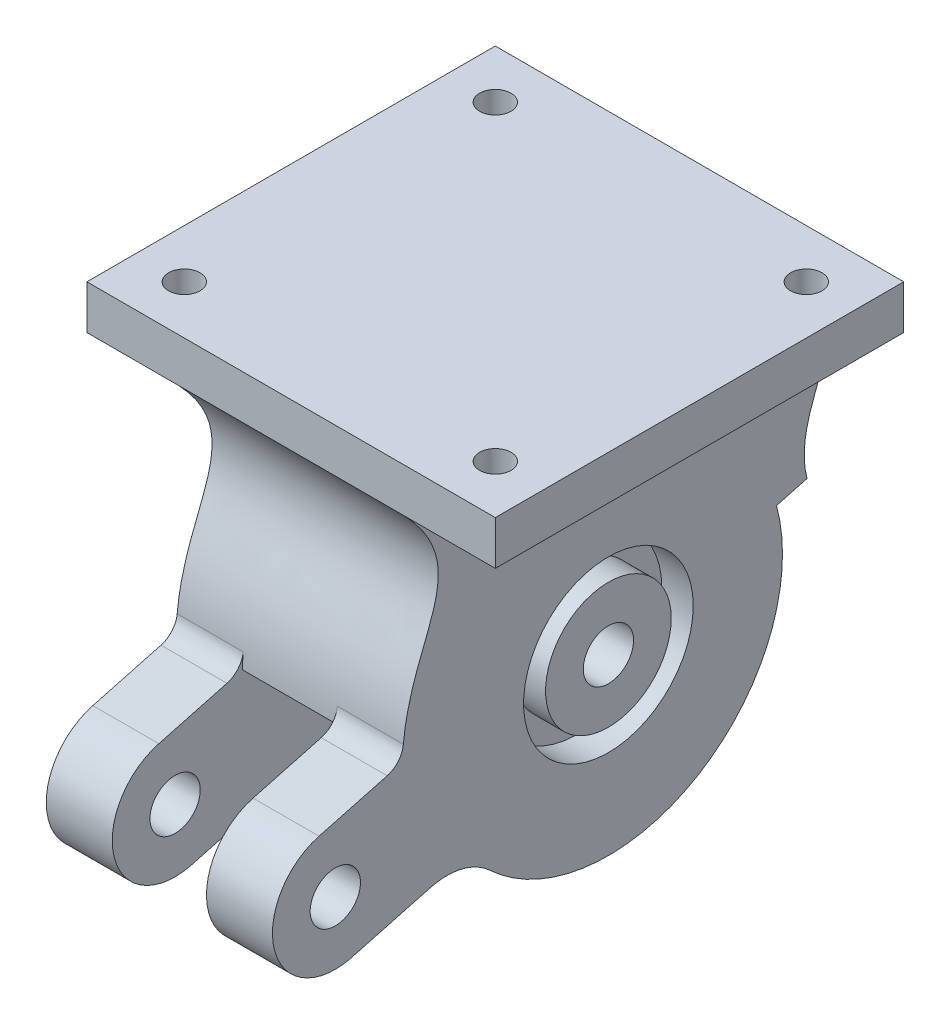
from build123d import *

# Parameters (mm, degrees)
SKETCH1_W                       = 65
SKETCH1_H                       = 65
SKETCH1_R                       = 2.5
BOSS_EXTRUDE1_DEPTH             = 7
BOSS_EXTRUDE2_START             = 7.5
SKETCH2_R                       = 4
BOSS_EXTRUDE2_DEPTH             = 10.5
BOSS_EXTRUDE3_REACH             = 80.065
BOSS_EXTRUDE3_DIRECTION_2_REACH = 80.065
BOSS_EXTRUDE7_START             = -18
BOSS_EXTRUDE7_DEPTH             = 36
SKETCH6_W                       = 15
SKETCH6_H                       = 30
CUT_EXTRUDE1_DEPTH              = 81.472268493
SKETCH8_R                       = 13.5
SKETCH8_R_2                     = 10
CUT_EXTRUDE3_DEPTH              = 5
CUT_EXTRUDE4_DEPTH              = 91.23260041
CUT_EXTRUDE4_DEPTH_BACK         = 91.23260041
SKETCH7_R                       = 4
FILLET16_R                      = 3.5
FILLET17_R                      = 3.5
FILLET19_R                      = 10


with BuildPart() as part:
    # Sketch1 → Boss-Extrude1 (new body)
    with BuildSketch(Plane(origin=(0, 0, 0), x_dir=(1, 0, 0), z_dir=(0, 1, 0))):
        Rectangle(SKETCH1_W, SKETCH1_H)
        with Locations(Location((-24.748737342, 24.748737342, 0), (0, 0, 270))):
            Circle(SKETCH1_R, mode=Mode.SUBTRACT)
        with Locations(Location((24.748737342, 24.748737342, 0), (0, 0, 270))):
            Circle(SKETCH1_R, mode=Mode.SUBTRACT)
        with Locations(Location((24.748737342, -24.748737342, 0), (0, 0, 270))):
            Circle(SKETCH1_R, mode=Mode.SUBTRACT)
        with Locations(Location((-24.748737342, -24.748737342, 0), (0, 0, 270))):
            Circle(SKETCH1_R, mode=Mode.SUBTRACT)
    extrude(amount=BOSS_EXTRUDE1_DEPTH)

    # Sketch2 → Boss-Extrude2 (add)
    with BuildSketch(Plane(origin=(0, 0, 0), x_dir=(0, 0, -1), z_dir=(1, 0, 0)).offset(BOSS_EXTRUDE2_START)):
        with BuildLine():
            Line((10, -9.568043047), (10, 1.517986249))
            Line((10, 1.517986249), (-10, 1.517986249))
            Line((-10, 1.517986249), (-10, -9.568043047))
            ThreePointArc((-10, -9.568043047), (0, -63.1), (10, -9.568043047))
        make_face()
        with Locations((0, -35.4)):
            Circle(SKETCH2_R, mode=Mode.SUBTRACT)
    boss_extrude2 = extrude(amount=BOSS_EXTRUDE2_DEPTH)

    # Mirror1: Boss-Extrude2 across plane
    add(boss_extrude2.mirror(Plane(origin=(0, 0, 0), x_dir=(0, 0, 1), z_dir=(1, 0, 0))))

    # Boss-Extrude3: up to this face of the body (flat: up to its plane)
    boss_extrude3_end = Plane(part.part.faces().sort_by_distance((18, -62.260311367, 0))[0])
    # Sketch3 → Boss-Extrude3 (add, up to the picked face)
    with BuildSketch(Plane(origin=(0, 0, 0), x_dir=(0, 0, -1), z_dir=(1, 0, 0)), mode=Mode.PRIVATE) as boss_extrude3_sk1:
        with BuildLine():
            Line((32.5, 0), (10, 0))
            Line((10, 0), (10, -4.266577445))
            Line((10, -4.266577445), (10, -9.568043047))
            ThreePointArc((10, -9.568043047), (20.611340647, -16.894253954), (26.756145388, -28.230712451))
            Line((26.756145388, -28.230712451), (31.61497925, -26.928791841))
            add(Edge.make_bspline(
                [(31.61497925, -26.928791841), (29.055948241, -17.442715383), (38.347474054, -9.80951762), (36, 0)],
                knots=[0, 0, 0, 0, 1, 1, 1, 1], degree=3))
            add(Edge.make_bspline(
                [(36, 0), (35.140208775, 3.592856394), (34.071491306, 4.753858958), (32.5, 7)],
                knots=[0, 0, 0, 0, 1, 1, 1, 1], degree=3))
            Line((32.5, 7), (32.5, 0))
        make_face()
    boss_extrude3_tool1 = split(extrude(boss_extrude3_sk1.sketch, amount=BOSS_EXTRUDE3_REACH, mode=Mode.PRIVATE), bisect_by=boss_extrude3_end, keep=Keep.BOTH, mode=Mode.PRIVATE)
    # Sketch3 → Boss-Extrude3 (add, up to the picked face)
    with BuildSketch(Plane(origin=(0, 0, 0), x_dir=(0, 0, -1), z_dir=(1, 0, 0)), mode=Mode.PRIVATE) as boss_extrude3_sk2:
        with BuildLine():
            Line((-32.5, 0), (-10, 0))
            Line((-10, 0), (-10, -9.568043047))
            ThreePointArc((-10, -9.568043047), (-24.698665766, -22.859429463), (-26.756145388, -42.569287549))
            Line((-26.756145388, -42.569287549), (-31.58577452, -43.863382775))
            add(Edge.make_bspline(
                [(-31.58577452, -43.863382775), (-37.603765688, -19.008690412), (-18.117487997, -15.033656142), (-32.5, 0)],
                knots=[0, 0, 0, 0, 1, 1, 1, 1], degree=3))
        make_face()
    boss_extrude3_tool2 = split(extrude(boss_extrude3_sk2.sketch, amount=BOSS_EXTRUDE3_REACH, mode=Mode.PRIVATE), bisect_by=boss_extrude3_end, keep=Keep.BOTH, mode=Mode.PRIVATE)
    add(boss_extrude3_tool1.solids().sort_by(Axis((0, -9.525708, -24.617363), (1, 0, 0)))[0])
    add(boss_extrude3_tool2.solids().sort_by(Axis((0, -14.994615, 23.210716), (1, 0, 0)))[0])

    # Boss-Extrude3 direction 2: up to this face of the body (flat: up to its plane)
    boss_extrude3_direction_2_end = Plane(part.part.faces().sort_by_distance((-18, -62.260311367, 0))[0])
    # Sketch3 → Boss-Extrude3 direction 2 (add, up to the picked face)
    with BuildSketch(Plane(origin=(0, 0, 0), x_dir=(0, 0, -1), z_dir=(1, 0, 0)), mode=Mode.PRIVATE) as boss_extrude3_direction_2_sk1:
        with BuildLine():
            Line((32.5, 0), (10, 0))
            Line((10, 0), (10, -4.266577445))
            Line((10, -4.266577445), (10, -9.568043047))
            ThreePointArc((10, -9.568043047), (20.611340647, -16.894253954), (26.756145388, -28.230712451))
            Line((26.756145388, -28.230712451), (31.61497925, -26.928791841))
            add(Edge.make_bspline(
                [(31.61497925, -26.928791841), (29.055948241, -17.442715383), (38.347474054, -9.80951762), (36, 0)],
                knots=[0, 0, 0, 0, 1, 1, 1, 1], degree=3))
            add(Edge.make_bspline(
                [(36, 0), (35.140208775, 3.592856394), (34.071491306, 4.753858958), (32.5, 7)],
                knots=[0, 0, 0, 0, 1, 1, 1, 1], degree=3))
            Line((32.5, 7), (32.5, 0))
        make_face()
    boss_extrude3_direction_2_tool1 = split(extrude(boss_extrude3_direction_2_sk1.sketch, amount=-BOSS_EXTRUDE3_DIRECTION_2_REACH, mode=Mode.PRIVATE), bisect_by=boss_extrude3_direction_2_end, keep=Keep.BOTH, mode=Mode.PRIVATE)
    # Sketch3 → Boss-Extrude3 direction 2 (add, up to the picked face)
    with BuildSketch(Plane(origin=(0, 0, 0), x_dir=(0, 0, -1), z_dir=(1, 0, 0)), mode=Mode.PRIVATE) as boss_extrude3_direction_2_sk2:
        with BuildLine():
            Line((-32.5, 0), (-10, 0))
            Line((-10, 0), (-10, -9.568043047))
            ThreePointArc((-10, -9.568043047), (-24.698665766, -22.859429463), (-26.756145388, -42.569287549))
            Line((-26.756145388, -42.569287549), (-31.58577452, -43.863382775))
            add(Edge.make_bspline(
                [(-31.58577452, -43.863382775), (-37.603765688, -19.008690412), (-18.117487997, -15.033656142), (-32.5, 0)],
                knots=[0, 0, 0, 0, 1, 1, 1, 1], degree=3))
        make_face()
    boss_extrude3_direction_2_tool2 = split(extrude(boss_extrude3_direction_2_sk2.sketch, amount=-BOSS_EXTRUDE3_DIRECTION_2_REACH, mode=Mode.PRIVATE), bisect_by=boss_extrude3_direction_2_end, keep=Keep.BOTH, mode=Mode.PRIVATE)
    add(boss_extrude3_direction_2_tool1.solids().sort_by(Axis((0, -9.525708, -24.617363), (-1, 0, 0)))[0])
    add(boss_extrude3_direction_2_tool2.solids().sort_by(Axis((0, -14.994615, 23.210716), (-1, 0, 0)))[0])

    # Sketch4 → Boss-Extrude7 (add)
    with BuildSketch(Plane(origin=(0, 0, 0), x_dir=(0, 0, -1), z_dir=(1, 0, 0)).offset(BOSS_EXTRUDE7_START)):
        with BuildLine():
            Line((-27.539944815, -32.426544169), (-33.139527425, -33.926947807))
            Line((-33.139527425, -33.926947807), (-55.714110897, -39.975789218))
            Line((-55.714110897, -39.975789218), (-50.537729995, -59.294305744))
            Line((-50.537729995, -59.294305744), (-22.363563913, -51.745060694))
            ThreePointArc((-22.363563913, -51.745060694), (-26.756145388, -42.569287549), (-27.539944815, -32.426544169))
        make_face()
    extrude(amount=BOSS_EXTRUDE7_DEPTH)

    # Sketch6 → Cut-Extrude1 (cut, through all)
    with BuildSketch(Plane(origin=(0, -23.369391384, -6.261809549), x_dir=(1, 0, 0), z_dir=(0, 0.9659258262890686, 0.2588190451025195))):
        with Locations((0, -49.162194197)):
            Rectangle(SKETCH6_W, SKETCH6_H)
    extrude(amount=-CUT_EXTRUDE1_DEPTH, mode=Mode.SUBTRACT)

    # Sketch8 → Cut-Extrude3 (cut)
    with BuildSketch(Plane(origin=(18, 0, 0), x_dir=(0, 0, -1), z_dir=(1, 0, 0))):
        with Locations((0, -35.4)):
            Circle(SKETCH8_R)
        with Locations((0, -35.4)):
            Circle(SKETCH8_R_2, mode=Mode.SUBTRACT)
    cut_extrude3 = extrude(amount=-CUT_EXTRUDE3_DEPTH, mode=Mode.SUBTRACT)

    # Mirror2: Cut-Extrude3 across plane
    add(cut_extrude3.mirror(Plane(origin=(0, 0, 0), x_dir=(0, 0, 1), z_dir=(1, 0, 0))), mode=Mode.SUBTRACT)

    # Sketch7 → Cut-Extrude4 (cut, two sides: drawn at the far end of the back side and taken through both)
    with BuildSketch(Plane(origin=(0, 0, 0), x_dir=(0, 0, -1), z_dir=(1, 0, 0)).offset(-CUT_EXTRUDE4_DEPTH_BACK)):
        with Locations(Location((-43.466662183, -47.04685703, 0), (0, 0, 180))):
            Circle(SKETCH7_R)
        with BuildLine():
            Line((-40.878471732, -56.706115293), (-40.166415946, -59.363543662))
            Line((-40.166415946, -59.363543662), (-53.107989986, -62.831227975))
            Line((-53.107989986, -62.831227975), (-59.564338385, -38.735807717))
            Line((-59.564338385, -38.735807717), (-46.622764346, -35.268123405))
            Line((-46.622764346, -35.268123405), (-46.054852634, -37.387598767))
            ThreePointArc((-46.054852634, -37.387598767), (-53.125920446, -49.635047481), (-40.878471732, -56.706115293))
        make_face()
    extrude(amount=CUT_EXTRUDE4_DEPTH + CUT_EXTRUDE4_DEPTH_BACK, mode=Mode.SUBTRACT)

    # Fillet16
    # the kernel refuses this fillet: 3.5 mm, written as the material it adds along each edge
    with BuildSketch(Plane(origin=(18, -33.827938234, 32.770018668), x_dir=(0, -0.25881904510252074, 0.9659258262890684), z_dir=(-1, 0, 0))) as fillet16_piece_1_section:
        with BuildLine():
            CenterArc((2.528363882, 3.5), FILLET16_R, 200.393732709, 69.606267291)
            Line((-0.752256512, 2.280356677), (-0.81786892, 2.255963811))
            ThreePointArc((-0.81786892, 2.255963811), (-0.421453854, 1.125231743), (-0.06723899, -0.019465823))
            Line((-0.06723899, -0.019465823), (0, -0.07))
            Line((0, -0.07), (2.528363882, -0.07))
            Line((2.528363882, -0.07), (2.528363882, 0))
        make_face()
    fillet16_piece_1 = extrude(amount=10.5, mode=Mode.PRIVATE)
    fillet16_piece_1 = split(fillet16_piece_1, bisect_by=Plane(origin=(12.75, -33.904495307, 33.055733556), z_dir=(0, 0.9659258262890686, 0.2588190451025195)), keep=Keep.TOP, mode=Mode.PRIVATE)
    add(fillet16_piece_1)

    # Fillet17
    # the kernel refuses this fillet: 3.5 mm, written as the material it adds along each edge
    with BuildSketch(Plane(origin=(-18, -33.827938234, 32.770018668), x_dir=(0, -0.25881904510252074, 0.9659258262890684), z_dir=(1, 0, 0))) as fillet17_piece_1_section:
        with BuildLine():
            CenterArc((2.528363882, -3.5), FILLET17_R, 90, 69.606267291)
            Line((-0.752256512, -2.280356677), (-0.81786892, -2.255963811))
            ThreePointArc((-0.81786892, -2.255963811), (-0.421453854, -1.125231743), (-0.06723899, 0.019465823))
            Line((-0.06723899, 0.019465823), (0, 0.07))
            Line((0, 0.07), (2.528363882, 0.07))
            Line((2.528363882, 0.07), (2.528363882, 0))
        make_face()
    fillet17_piece_1 = extrude(amount=10.5, mode=Mode.PRIVATE)
    fillet17_piece_1 = split(fillet17_piece_1, bisect_by=Plane(origin=(-12.75, -33.904495307, 33.055733556), z_dir=(0, 0.9659258262890686, 0.2588190451025195)), keep=Keep.TOP, mode=Mode.PRIVATE)
    add(fillet17_piece_1)

    # Fillet19
    fillet19_edges = [part.edges().sort_by_distance(p)[0] for p in [
        (12.75, -51.745060694, 22.363563913),
        (-12.75, -51.745060694, 22.363563913),
    ]]
    fillet(fillet19_edges, radius=FILLET19_R)


solid = part.part
